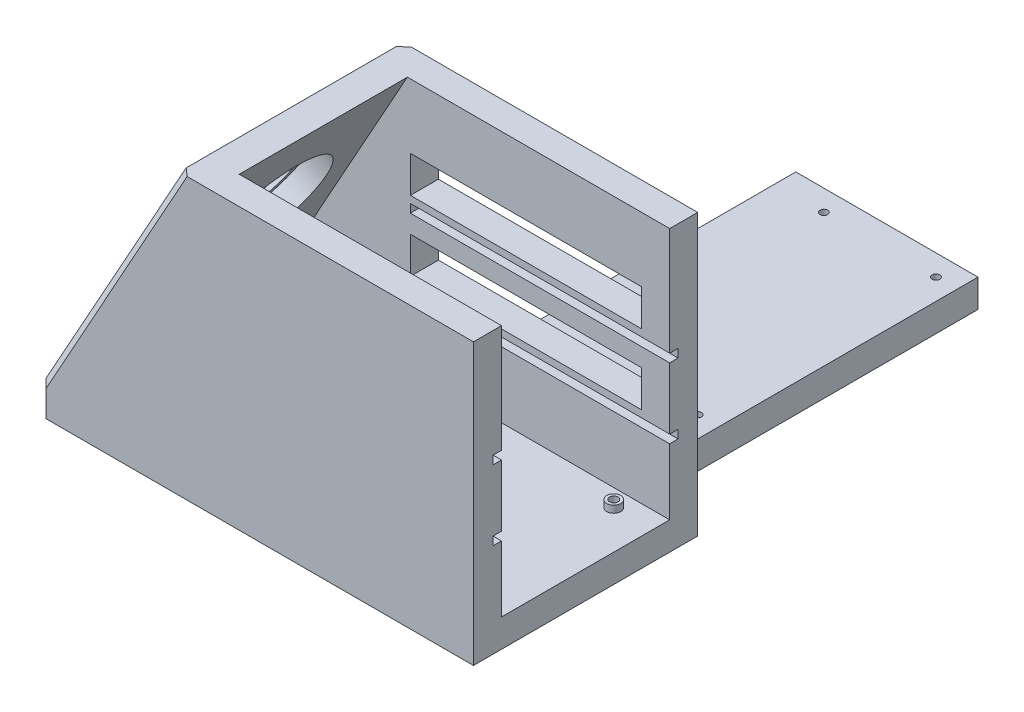
from build123d import *

# Parameters (mm, degrees)
BOSS_EXTRUDE1_DEPTH = 10
SKETCH4_W           = 75
SKETCH4_H           = 90
SKETCH4_W_2         = 30
BOSS_EXTRUDE3_DEPTH = 80
SHELL1_T            = -10
SKETCH5_R           = 5
SKETCH5_R_2         = 18.92
CUT_EXTRUDE1_DEPTH  = 10
CHAMFER1_SIZE       = 1
SKETCH5_3_W         = 10
SKETCH5_3_H         = 3.5
CUT_EXTRUDE2_DEPTH  = 2
CHAMFER2_SIZE       = 0.25
CHAMFER3_SIZE       = 20
CHAMFER4_SIZE       = 1
CHAMFER5_SIZE       = 2.5
SKETCH6_R           = 1.499997567
SKETCH6_R_2         = 1.499999999
SKETCH6_R_3         = 1.499994186
SKETCH6_R_4         = 1.4999946
CUT_EXTRUDE3_DEPTH  = 5
BOSS_EXTRUDE4_START = 2.5
SKETCH7_R           = 2.5
SKETCH7_R_2         = 1.499994186
SKETCH7_R_3         = 1.4999946
SKETCH7_R_4         = 1.499997567
SKETCH7_R_5         = 1.499999999
BOSS_EXTRUDE4_DEPTH = 2.5
SKETCH10_W          = 66
SKETCH10_H          = 3
CUT_EXTRUDE4_DEPTH  = 92.5
SKETCH11_W          = 82.5
SKETCH11_H          = 13
CUT_EXTRUDE5_DEPTH  = 10
SKETCH12_R          = 1.374999986
SKETCH12_R_2        = 1.374999981
SKETCH12_R_3        = 1.367900497
SKETCH12_R_4        = 1.37499998
CUT_EXTRUDE6_DEPTH  = 10
SKETCH16_R          = 20.92
CUT_EXTRUDE7_DEPTH  = 7.5
SKETCH16_4_W        = 28
SKETCH16_4_H        = 16
CUT_EXTRUDE9_DEPTH  = 5.7
SKETCH16_5_R        = 0.925
CUT_EXTRUDE10_DEPTH = 7.5
SKETCH17_W          = 28
SKETCH17_H          = 2.5
CUT_EXTRUDE11_DEPTH = 1.85


with BuildPart() as part:
    # Sketch1 → Boss-Extrude1 (new body)
    with BuildSketch(Plane(origin=(0, 0, 0), x_dir=(1, 0, 0), z_dir=(0, 1, 0))):
        Polygon((-27.5, 50), (-27.5, -70), (-97.5, -70), (-97.5, -150), (57.5, -150), (57.5, -70), (37.5, -70), (37.5, 50), align=None)
    extrude(amount=BOSS_EXTRUDE1_DEPTH)

    # Sketch4 → Boss-Extrude3 (add)
    with BuildSketch(Plane.XY.offset(150)):
        Polygon((-97.5, 10), (-47.5, 10), (-47.5, 100), align=None)
        with Locations((-10, 55)):
            Rectangle(SKETCH4_W, SKETCH4_H)
        with Locations((42.5, 55)):
            Rectangle(SKETCH4_W_2, SKETCH4_H)
    extrude(amount=-BOSS_EXTRUDE3_DEPTH)

    # Shell1
    shell1_openings = [part.faces().sort_by_distance(p)[0] for p in [
        (57.5, 50, 110),
        (5, 100, 110),
    ]]
    offset(amount=SHELL1_T, openings=shell1_openings, kind=Kind.INTERSECTION)

    # Sketch5 → Cut-Extrude1 (cut)
    with BuildSketch(Plane(origin=(-78.75, 43.75, 0), x_dir=(0, 0, 1), z_dir=(-0.8741572761215377, 0.48564293117863233, 0))):
        with Locations(Location((127.5, -8.608613029, 0), (0, 0, 270))):
            Circle(SKETCH5_R)
        with Locations(Location((92.5, -8.608613029, 0), (0, 0, 270))):
            Circle(SKETCH5_R)
        with Locations(Location((110, -8.608613029, 0), (0, 0, 270))):
            Circle(SKETCH5_R)
        with Locations(Location((110, 29.347688381, 0), (0, 0, 270))):
            Circle(SKETCH5_R_2)
    extrude(amount=-CUT_EXTRUDE1_DEPTH, mode=Mode.SUBTRACT)

    # Chamfer1
    chamfer1_edges = [part.edges().sort_by_distance(p)[0] for p in [
        (-55.309138333, 85.943551, 110),
    ]]
    chamfer(chamfer1_edges, length=CHAMFER1_SIZE)

    # Sketch5<3> → Cut-Extrude2 (cut)
    # profile 1 of 9: a face of its own
    with BuildSketch(Plane(origin=(-78.75, 43.75, 0), x_dir=(0, 0, 1), z_dir=(-0.8741572761215377, 0.48564293117863233, 0))):
        Polygon((110.942307692, -16.858613029), (110.942307692, -20.358613029), (111.570512821, -20.358613029), (111.570512821, -18.717286907), (112.721053686, -20.358613029), (113.477564103, -20.358613029), (112.108974359, -18.406689952), (113.356270032, -16.858613029), (112.563301282, -16.858613029), (111.570512821, -18.090484022), (111.570512821, -16.858613029), align=None)
    # profile 2 of 9: a face of its own
    with BuildSketch(Plane(origin=(-78.75, 43.75, 0), x_dir=(0, 0, 1), z_dir=(-0.8741572761215377, 0.48564293117863233, 0))):
        Polygon((95, -25.358613029), (95, -23.608613029), (95, -21.858613029), (85, -21.858613029), (85, -23.608613029), (85, -25.358613029), align=None)
    # profile 3 of 9: a face of its own
    with BuildSketch(Plane(origin=(-78.75, 43.75, 0), x_dir=(0, 0, 1), z_dir=(-0.8741572761215377, 0.48564293117863233, 0))):
        with BuildLine():
            add(Edge.make_bspline(
                [(110, -19.662804349), (109.971724739, -19.703363572), (109.904355617, -19.791541096), (109.789093006, -19.919551888), (109.654562054, -20.04274149), (109.512072477, -20.151303485), (109.362282281, -20.243289891), (109.22084721, -20.311263344), (109.128455085, -20.345772792), (109.089803205, -20.358613029)],
                knots=[0.386803631, 0.386803631, 0.386803631, 0.386803631, 0.438619601, 0.502972902, 0.567128646, 0.62955229, 0.690476782, 0.751072338, 0.793746598, 0.793746598, 0.793746598, 0.793746598], degree=3))
            Line((110, -19.662804349), (110, -17.571583326))
            add(Edge.make_bspline(
                [(108.50380609, -16.768869439), (108.623863109, -16.768917164), (108.80234464, -16.784553835), (109.03172943, -16.841779079), (109.195494453, -16.900444425), (109.352358411, -16.977256934), (109.502872124, -17.069941398), (109.646497093, -17.180273738), (109.781761533, -17.305672832), (109.901407188, -17.436189444), (109.970272766, -17.528205121), (110, -17.571583326)],
                knots=[0, 0, 0, 0, 0.125157267, 0.185649467, 0.245976679, 0.306108369, 0.367350588, 0.429902078, 0.494539958, 0.559372583, 0.614151435, 0.614151435, 0.614151435, 0.614151435], degree=3))
            add(Edge.make_bspline(
                [(106.679487179, -18.607210785), (106.678556079, -18.524892519), (106.687390293, -18.402528917), (106.712290801, -18.242060709), (106.739460803, -18.125368429), (106.772524782, -18.010710547), (106.815347137, -17.899152941), (106.864094599, -17.789504241), (106.921050305, -17.683059435), (106.984379833, -17.580797932), (107.053477909, -17.483202109), (107.128518371, -17.391452045), (107.209259465, -17.304944796), (107.29597944, -17.224248981), (107.387537585, -17.148222233), (107.485709594, -17.078884116), (107.588346789, -17.014541162), (107.694870532, -16.956357217), (107.804847144, -16.906831792), (107.916011005, -16.863585746), (108.029846689, -16.829440777), (108.145135822, -16.80167996), (108.303093746, -16.776855782), (108.423114469, -16.767945494), (108.50380609, -16.768869439)],
                knots=[0, 0, 0, 0, 0.085682765, 0.127594324, 0.169058623, 0.210432029, 0.251811166, 0.29344384, 0.335380853, 0.377476606, 0.418688491, 0.459873034, 0.500872905, 0.541872776, 0.583211777, 0.624763202, 0.666987622, 0.709369706, 0.751102652, 0.79256838, 0.833545109, 0.874827423, 0.916017723, 1, 1, 1, 1], degree=3))
            add(Edge.make_bspline(
                [(107.913101718, -20.358613029), (107.87078902, -20.344654388), (107.773923919, -20.308059444), (107.626760892, -20.237830902), (107.474916598, -20.143495264), (107.331839325, -20.031570865), (107.198349561, -19.904932443), (107.077407856, -19.766361719), (106.970651853, -19.619974117), (106.880605199, -19.466888005), (106.807243365, -19.30703083), (106.749467189, -19.141399568), (106.694240901, -18.908996921), (106.680369759, -18.72853886), (106.679487179, -18.607210785)],
                knots=[0.209109415, 0.209109415, 0.209109415, 0.209109415, 0.255325543, 0.316388186, 0.378026863, 0.440405679, 0.504557429, 0.568658287, 0.630986179, 0.692288135, 0.752615447, 0.813199538, 0.874016125, 1, 1, 1, 1], degree=3))
            Line((107.913101718, -20.358613029), (109.089803205, -20.358613029))
        make_face()
        with BuildLine():
            add(Edge.make_bspline(
                [(108.493990385, -17.397074567), (108.41319064, -17.397313304), (108.293601778, -17.407440648), (108.139837432, -17.443283114), (108.031388947, -17.481469529), (107.927838803, -17.530128541), (107.829004224, -17.589030356), (107.736253675, -17.660215741), (107.648350391, -17.739858771), (107.568944477, -17.828599685), (107.498785966, -17.92370061), (107.440077813, -18.025002742), (107.390897363, -18.131565259), (107.35392021, -18.244585395), (107.317957229, -18.405473954), (107.307808266, -18.530874878), (107.307692308, -18.615624247)],
                knots=[0, 0, 0, 0, 0.12751179, 0.188521308, 0.248708179, 0.308598265, 0.368812249, 0.429887502, 0.492802448, 0.555743332, 0.617485295, 0.678968963, 0.740197691, 0.802360102, 0.866244776, 1, 1, 1, 1], degree=3))
            add(Edge.make_bspline(
                [(109.685897436, -18.610716394), (109.685439331, -18.528813618), (109.676050669, -18.407142884), (109.638793203, -18.251082377), (109.600824413, -18.140456723), (109.552288766, -18.034573172), (109.492282878, -17.933806533), (109.42100299, -17.838253582), (109.34009348, -17.748565587), (109.252028224, -17.666148248), (109.157481366, -17.594624292), (109.05909868, -17.532474747), (108.954621609, -17.483780285), (108.846192082, -17.44501921), (108.693588392, -17.406321576), (108.574192214, -17.397899564), (108.493990385, -17.397074567)],
                knots=[0, 0, 0, 0, 0.129791109, 0.192175236, 0.253617044, 0.314719108, 0.376282275, 0.438972992, 0.503174702, 0.567329465, 0.629650994, 0.690649867, 0.751237613, 0.811754114, 0.872787777, 1, 1, 1, 1], degree=3))
            add(Edge.make_bspline(
                [(108.506610577, -19.82015149), (108.585708827, -19.819664421), (108.703274416, -19.810379392), (108.853867301, -19.772899224), (108.961140261, -19.735043935), (109.063915058, -19.685775108), (109.161686485, -19.625046004), (109.254626727, -19.553587934), (109.342418022, -19.472898997), (109.422663156, -19.383808506), (109.492675345, -19.288200335), (109.553249943, -19.188180929), (109.601408825, -19.082334729), (109.639845229, -18.9716607), (109.675291814, -18.814748402), (109.685895454, -18.692951971), (109.685897436, -18.610716394)],
                knots=[0, 0, 0, 0, 0.126212115, 0.186841289, 0.246935869, 0.307256361, 0.368150502, 0.430070767, 0.493875442, 0.557980682, 0.620869526, 0.682524731, 0.744035698, 0.805888683, 0.868968138, 1, 1, 1, 1], degree=3))
            add(Edge.make_bspline(
                [(107.73818109, -19.550920721), (107.792870033, -19.594731494), (107.879250159, -19.653579144), (108.002476079, -19.716369146), (108.097335552, -19.754198426), (108.195359808, -19.783889362), (108.331362467, -19.812050037), (108.436205248, -19.820196394), (108.506610577, -19.82015149)],
                knots=[0, 0, 0, 0, 0.253098392, 0.376184058, 0.498936312, 0.621525881, 0.745706894, 1, 1, 1, 1], degree=3))
            add(Edge.make_bspline(
                [(107.307692308, -18.615624247), (107.30861791, -18.709515157), (107.319295887, -18.848219339), (107.365076998, -19.024305411), (107.413468715, -19.145584934), (107.47357976, -19.259902971), (107.573991543, -19.403068579), (107.668925036, -19.495536714), (107.73818109, -19.550920721)],
                knots=[0, 0, 0, 0, 0.264199056, 0.388461817, 0.509942098, 0.630409611, 0.750671035, 1, 1, 1, 1], degree=3))
        make_face(mode=Mode.SUBTRACT)
    # profile 4 of 9: a face of its own
    with BuildSketch(Plane(origin=(-78.75, 43.75, 0), x_dir=(0, 0, 1), z_dir=(-0.8741572761215377, 0.48564293117863233, 0))):
        with BuildLine():
            Line((110, -17.571583326), (110, -19.662804349))
            add(Edge.make_bspline(
                [(110.314102564, -18.619129856), (110.313571156, -18.74258504), (110.299144228, -18.925947757), (110.242674841, -19.161161635), (110.185403384, -19.328234267), (110.110220256, -19.487433529), (110.044957649, -19.597209692), (110.005921728, -19.654309974), (110, -19.662804349)],
                knots=[0, 0, 0, 0, 0.129507931, 0.191722103, 0.253161125, 0.314315704, 0.37595174, 0.386803631, 0.386803631, 0.386803631, 0.386803631], degree=3))
            add(Edge.make_bspline(
                [(110, -17.571583326), (110.004481565, -17.578122859), (110.042230778, -17.633956587), (110.107457868, -17.742336633), (110.184032962, -17.902874534), (110.242280357, -18.071587086), (110.297911002, -18.309440668), (110.31444748, -18.494346691), (110.314102564, -18.619129856)],
                knots=[0.614151435, 0.614151435, 0.614151435, 0.614151435, 0.622409686, 0.684357426, 0.745806601, 0.807430275, 0.869995516, 1, 1, 1, 1], degree=3))
        make_face()
    # profile 5 of 9: a face of its own
    with BuildSketch(Plane(origin=(-78.75, 43.75, 0), x_dir=(0, 0, 1), z_dir=(-0.8741572761215377, 0.48564293117863233, 0))):
        with BuildLine():
            add(Edge.make_bspline(
                [(109.089803205, -20.358613029), (109.07357113, -20.364005359), (109.001483682, -20.386724008), (108.809903736, -20.43311751), (108.629882897, -20.44796958), (108.508713942, -20.448356618)],
                knots=[0.793746598, 0.793746598, 0.793746598, 0.793746598, 0.811667894, 0.872929356, 1, 1, 1, 1], degree=3))
            Line((109.089803205, -20.358613029), (107.913101718, -20.358613029))
            add(Edge.make_bspline(
                [(108.508713942, -20.448356618), (108.382186019, -20.449247538), (108.195530355, -20.431624098), (107.998880397, -20.385788921), (107.92718017, -20.363257404), (107.913101718, -20.358613029)],
                knots=[0, 0, 0, 0, 0.131151976, 0.193732197, 0.209109415, 0.209109415, 0.209109415, 0.209109415], degree=3))
        make_face()
    # profile 6 of 9: a face of its own
    with BuildSketch(Plane(origin=(-78.75, 43.75, 0), x_dir=(0, 0, 1), z_dir=(-0.8741572761215377, 0.48564293117863233, 0))):
        Polygon((85, -28.108613029), (85, -25.358613029), (85, -23.608613029), (79.5, -23.608613029), align=None)
    # profile 7 of 9: a face of its own
    with BuildSketch(Plane(origin=(-78.75, 43.75, 0), x_dir=(0, 0, 1), z_dir=(-0.8741572761215377, 0.48564293117863233, 0))):
        Polygon((85, -23.608613029), (85, -21.858613029), (85, -19.108613029), (79.5, -23.608613029), align=None)
    # profile 8 of 9: a face of its own
    with BuildSketch(Plane(origin=(-78.75, 43.75, 0), x_dir=(0, 0, 1), z_dir=(-0.8741572761215377, 0.48564293117863233, 0))):
        Polygon((140.5, -23.608613029), (135, -19.108613029), (135, -21.858613029), (135, -25.358613029), (135, -28.108613029), align=None)
    # profile 9 of 9: a face of its own
    with BuildSketch(Plane(origin=(-78.75, 43.75, 0), x_dir=(0, 0, 1), z_dir=(-0.8741572761215377, 0.48564293117863233, 0))):
        with Locations((130, -23.608613029)):
            Rectangle(SKETCH5_3_W, SKETCH5_3_H)
    extrude(amount=-CUT_EXTRUDE2_DEPTH, mode=Mode.SUBTRACT)

    # Chamfer2
    chamfer2_edges = [part.edges().sort_by_distance(p)[0] for p in [
        (-89.365480903, 24.642134375, 90),
        (-88.697721872, 25.84410063, 85),
        (-89.122659437, 25.079213013, 82.25),
        (-91.308052627, 21.145505271, 82.25),
        (-91.732990192, 20.380617654, 85),
        (-91.065231162, 21.582583909, 90),
        (-90.215356032, 23.112359142, 95),
        (-88.057701088, 26.996138042, 110.238428824),
        (-87.525837654, 27.953492224, 110.23879361),
        (-86.996480416, 28.906335251, 109.352483609),
        (-87.155365371, 28.620342332, 107.208458503),
        (-88.307740911, 26.54606636, 107.015808241),
        (-88.670115556, 25.893792, 108.207367722),
        (-88.670146728, 25.893735889, 108.802919095),
        (-88.503322198, 26.194020043, 109.599957572),
        (-87.787141376, 27.483145522, 110.942307692),
        (-88.637016506, 25.953370289, 111.256410256),
        (-88.238467292, 26.670758875, 111.570512821),
        (-88.238467292, 26.670758875, 112.145783253),
        (-88.637016506, 25.953370289, 113.099308894),
        (-88.163047684, 26.806514169, 112.793269231),
        (-87.313172554, 28.336289402, 112.732622196),
        (-86.937266247, 29.012920756, 112.959785657),
        (-87.236390967, 28.474496259, 112.066907051),
        (-87.236390967, 28.474496259, 111.570512821),
        (-86.937266247, 29.012920756, 111.256410256),
        (-89.122659437, 25.079213013, 137.75),
        (-88.697721872, 25.84410063, 135),
        (-89.365480903, 24.642134375, 130),
        (-90.215356032, 23.112359142, 125),
        (-91.065231162, 21.582583909, 130),
        (-91.732990192, 20.380617654, 135),
        (-91.308052627, 21.145505271, 137.75),
        (-87.370691445, 28.232755399, 107.640250529),
        (-88.042938915, 27.022709954, 107.411270289),
        (-88.342970532, 26.482653043, 108.098690222),
        (-88.202294274, 26.735870307, 109.349020106),
        (-87.372121836, 28.230180696, 109.343043501),
    ]]
    chamfer(chamfer2_edges, length=CHAMFER2_SIZE)

    # Chamfer3
    chamfer3_edges = [part.edges().sort_by_distance(p)[0] for p in [
        (37.5, 5, 70),
    ]]
    chamfer(chamfer3_edges, length=CHAMFER3_SIZE - 0.0001)  # a hair under: the kernel refuses the full size

    # Chamfer4
    chamfer4_edges = [part.edges().sort_by_distance(p)[0] for p in [
        (-27.5, 5, 70),
    ]]
    chamfer(chamfer4_edges, length=CHAMFER4_SIZE)

    # Chamfer5
    chamfer5_edges = [part.edges().sort_by_distance(p)[0] for p in [
        (-97.5, 5, 150),
        (-97.5, 5, 70),
        (-72.5, 55, 70),
        (-72.5, 55, 150),
    ]]
    chamfer(chamfer5_edges, length=CHAMFER5_SIZE)

    # Sketch6 → Cut-Extrude3 (cut)
    with BuildSketch(Plane(origin=(-26.001038623, 10, 43.255677443), x_dir=(1, 0, 0), z_dir=(0, 1, 0))):
        with Locations(Location((69.729127292, -42.921613211, 0), (0, 0, 270))):
            Circle(SKETCH6_R)
        with Locations(Location((61.45623901, -91.617450002, 0), (0, 0, 270))):
            Circle(SKETCH6_R_2)
        with Locations(Location((-14.270863274, -42.882150483, 0), (0, 0, 270))):
            Circle(SKETCH6_R_3)
        with Locations(Location((-13.043752623, -91.582450321, 0), (0, 0, 270))):
            Circle(SKETCH6_R_4)
    extrude(amount=-CUT_EXTRUDE3_DEPTH, mode=Mode.SUBTRACT)

    # Sketch7 → Boss-Extrude4 (add)
    # profile 1 of 4: a face of its own
    with BuildSketch(Plane(origin=(0, 10, 0), x_dir=(1, 0, 0), z_dir=(0, 1, 0)).offset(BOSS_EXTRUDE4_START)):
        with Locations(Location((-40.271901897, -86.137827926, 0), (0, 0, 270))):
            Circle(SKETCH7_R)
        with Locations(Location((-40.271901897, -86.137827926, 0), (0, 0, 270))):
            Circle(SKETCH7_R_2, mode=Mode.SUBTRACT)
    # profile 2 of 4: a face of its own
    with BuildSketch(Plane(origin=(0, 10, 0), x_dir=(1, 0, 0), z_dir=(0, 1, 0)).offset(BOSS_EXTRUDE4_START)):
        with Locations(Location((-39.044791246, -134.838127764, 0), (0, 0, 270))):
            Circle(SKETCH7_R)
        with Locations(Location((-39.044791246, -134.838127764, 0), (0, 0, 270))):
            Circle(SKETCH7_R_3, mode=Mode.SUBTRACT)
    # profile 3 of 4: a face of its own
    with BuildSketch(Plane(origin=(0, 10, 0), x_dir=(1, 0, 0), z_dir=(0, 1, 0)).offset(BOSS_EXTRUDE4_START)):
        with Locations(Location((43.72808867, -86.177290654, 0), (0, 0, 270))):
            Circle(SKETCH7_R)
        with Locations(Location((43.72808867, -86.177290654, 0), (0, 0, 270))):
            Circle(SKETCH7_R_4, mode=Mode.SUBTRACT)
    # profile 4 of 4: a face of its own
    with BuildSketch(Plane(origin=(0, 10, 0), x_dir=(1, 0, 0), z_dir=(0, 1, 0)).offset(BOSS_EXTRUDE4_START)):
        with Locations(Location((35.455200387, -134.873127445, 0), (0, 0, 270))):
            Circle(SKETCH7_R)
        with Locations(Location((35.455200387, -134.873127445, 0), (0, 0, 270))):
            Circle(SKETCH7_R_5, mode=Mode.SUBTRACT)
    extrude(amount=-BOSS_EXTRUDE4_DEPTH)

    # Sketch10 → Cut-Extrude4 (cut)
    with BuildSketch(Plane(origin=(57.5, 0, 0), x_dir=(0, 0, -1), z_dir=(1, 0, 0))):
        with Locations((-110, 35)):
            Rectangle(SKETCH10_W, SKETCH10_H)
        with Locations((-110, 60)):
            Rectangle(SKETCH10_W, SKETCH10_H)
    extrude(amount=-CUT_EXTRUDE4_DEPTH, mode=Mode.SUBTRACT)

    # Sketch11 → Cut-Extrude5 (cut)
    with BuildSketch(Plane(origin=(-26.001038623, 40.437498734, 80), x_dir=(1, 0, 0), z_dir=(0, 0, 1))):
        with Locations((32.251038623, 30.062501266)):
            Rectangle(SKETCH11_W, SKETCH11_H)
        with Locations((32.251038623, 5.062501266)):
            Rectangle(SKETCH11_W, SKETCH11_H)
    extrude(amount=-CUT_EXTRUDE5_DEPTH, mode=Mode.SUBTRACT)

    # Sketch12 → Cut-Extrude6 (cut)
    with BuildSketch(Plane(origin=(-57.5, 10, -0.040841614), x_dir=(0, 0, 1), z_dir=(0, 1, 0))):
        with Locations((-42.45975331, 87.5)):
            Circle(SKETCH12_R)
        with Locations((42.54024502, 87.5)):
            Circle(SKETCH12_R_2)
        with Locations((42.533145544, 47.5)):
            Circle(SKETCH12_R_3)
        with Locations((-42.45975331, 47.5)):
            Circle(SKETCH12_R_4)
    extrude(amount=-CUT_EXTRUDE6_DEPTH, mode=Mode.SUBTRACT)

    # Sketch16 → Cut-Extrude7 (cut)
    with BuildSketch(Plane(origin=(-70.008427239, 38.893570688, 0), x_dir=(0, 0, -1), z_dir=(0.8741572761215377, -0.48564293117863233, 0))):
        with Locations(Location((-110, 29.347688381, 0), (0, 0, 90))):
            Circle(SKETCH16_R)
    extrude(amount=-CUT_EXTRUDE7_DEPTH, mode=Mode.SUBTRACT)

    # Sketch16<4> → Cut-Extrude9 (cut)
    with BuildSketch(Plane(origin=(-70.008427239, 38.893570688, 0), x_dir=(0, 0, -1), z_dir=(0.8741572761215377, -0.48564293117863233, 0))):
        with Locations((-110, 8.823827359)):
            Rectangle(SKETCH16_4_W, SKETCH16_4_H)
    extrude(amount=-CUT_EXTRUDE9_DEPTH, mode=Mode.SUBTRACT)

    # Sketch16<5> → Cut-Extrude10 (cut)
    with BuildSketch(Plane(origin=(-70.008427239, 38.893570688, 0), x_dir=(0, 0, -1), z_dir=(0.8741572761215377, -0.48564293117863233, 0))):
        with Locations(Location((-119.625, 9.248827359, 0), (0, 0, 90))):
            Circle(SKETCH16_5_R)
        with Locations(Location((-100.375, 9.248827359, 0), (0, 0, 270))):
            Circle(SKETCH16_5_R)
    extrude(amount=-CUT_EXTRUDE10_DEPTH, mode=Mode.SUBTRACT)

    # Sketch17 → Cut-Extrude11 (cut)
    with BuildSketch(Plane(origin=(-74.991123713, 41.661735396, 0), x_dir=(0, 0, -1), z_dir=(0.8741572761215376, -0.48564293117863233, 0))):
        with Locations((-110, 2.073827359)):
            Rectangle(SKETCH17_W, SKETCH17_H)
    extrude(amount=-CUT_EXTRUDE11_DEPTH, mode=Mode.SUBTRACT)


solid = part.part
